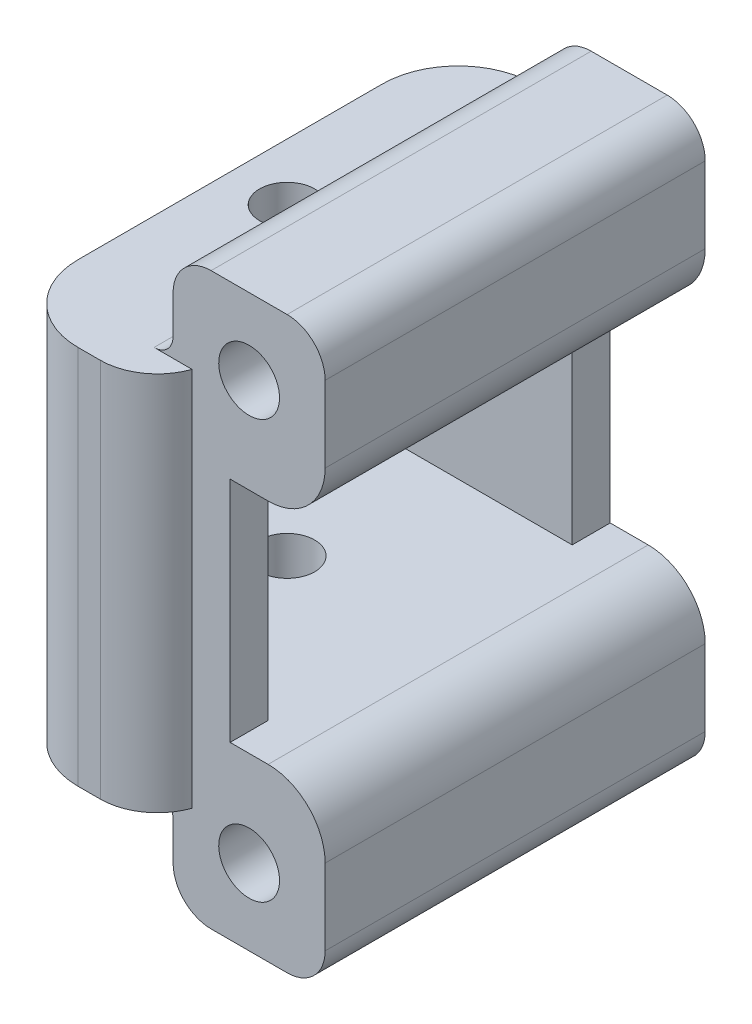
from build123d import *

# Parameters (mm, degrees)
SKETCH1_W           = 20
SKETCH1_H           = 20
BOSS_EXTRUDE1_DEPTH = 4
SKETCH2_R           = 3.7
CUT_EXTRUDE1_DEPTH  = 2.6
SKETCH3_R           = 2.1
CUT_EXTRUDE2_DEPTH  = 29.403520909
SKETCH4_W           = 12
SKETCH4_H           = 4
BOSS_EXTRUDE2_DEPTH = 12
SKETCH7_W           = 20
SKETCH7_H           = 4
BOSS_EXTRUDE3_DEPTH = 5
SKETCH8_W           = 8
SKETCH8_H           = 20
BOSS_EXTRUDE4_DEPTH = 5
SKETCH9_W           = 8
SKETCH9_H           = 20
BOSS_EXTRUDE5_DEPTH = 5
SKETCH10_R          = 1.6
CUT_EXTRUDE5_DEPTH  = 39.288379438
SKETCH11_W          = 30
SKETCH11_H          = 30
CUT_EXTRUDE6_DEPTH  = 6
SKETCH12_R          = 1.45
CUT_EXTRUDE7_DEPTH  = 39.288379438
SKETCH13_W          = 8
SKETCH13_H          = 20
BOSS_EXTRUDE6_DEPTH = 2
SKETCH14_W          = 8
SKETCH14_H          = 20
BOSS_EXTRUDE7_DEPTH = 2
SKETCH15_W          = 16
SKETCH15_H          = 12
CUT_EXTRUDE8_DEPTH  = 37.523964735
FILLET2_R           = 3
FILLET4_R           = 2
FILLET5_START       = -21
FILLET5_DEPTH       = 22
FILLET6_R           = 3
FILLET7_R           = 1
FILLET8_R           = 1


with BuildPart() as part:
    # Sketch1 → Boss-Extrude1 (new body)
    with BuildSketch(Plane(origin=(0, 0, 0), x_dir=(0, 0, -1), z_dir=(1, 0, 0))):
        with Locations((-10, -10)):
            Rectangle(SKETCH1_W, SKETCH1_H)
    extrude(amount=BOSS_EXTRUDE1_DEPTH)

    # Sketch2 → Cut-Extrude1 (cut)
    with BuildSketch(Plane(origin=(4, 0, 0), x_dir=(0, 0, -1), z_dir=(1, 0, 0))):
        with Locations((-10, -10)):
            Circle(SKETCH2_R)
    extrude(amount=-CUT_EXTRUDE1_DEPTH, mode=Mode.SUBTRACT)

    # Sketch3 → Cut-Extrude2 (cut, through all)
    with BuildSketch(Plane(origin=(1.4, 0, 0), x_dir=(0, 0, -1), z_dir=(1, 0, 0))):
        with Locations((-10, -10)):
            Circle(SKETCH3_R)
    extrude(amount=-CUT_EXTRUDE2_DEPTH, mode=Mode.SUBTRACT)

    # Sketch4 → Boss-Extrude2 (add)
    with BuildSketch(Plane(origin=(4, 0, 0), x_dir=(0, 0, -1), z_dir=(1, 0, 0))):
        Polygon((-20, 0), (-20, -20), (-16, -20), (-16, -16), (-16, -4), (-16, 0), align=None)
        with Locations((-10, -18)):
            Rectangle(SKETCH4_W, SKETCH4_H)
        Polygon((-4, -16), (-4, -20), (0, -20), (0, -4), (-4, -4), align=None)
        Polygon((0, 0), (-16, 0), (-16, -4), (-4, -4), (0, -4), align=None)
    extrude(amount=BOSS_EXTRUDE2_DEPTH)

    # Sketch7 → Boss-Extrude3 (add)
    with BuildSketch(Plane(origin=(16, 0, 0), x_dir=(0, 0, -1), z_dir=(1, 0, 0))):
        with Locations((-10, -18)):
            Rectangle(SKETCH7_W, SKETCH7_H)
        with Locations((-10, -2)):
            Rectangle(SKETCH7_W, SKETCH7_H)
    extrude(amount=BOSS_EXTRUDE3_DEPTH)

    # Sketch8 → Boss-Extrude4 (add)
    with BuildSketch(Plane(origin=(0, -20, 0), x_dir=(-1, 0, 0), z_dir=(0, -1, 0))):
        with Locations((-17, -10)):
            Rectangle(SKETCH8_W, SKETCH8_H)
    extrude(amount=BOSS_EXTRUDE4_DEPTH)

    # Sketch9 → Boss-Extrude5 (add)
    with BuildSketch(Plane(origin=(0, 0, 0), x_dir=(1, 0, 0), z_dir=(0, 1, 0))):
        with Locations((17, -10)):
            Rectangle(SKETCH9_W, SKETCH9_H)
    extrude(amount=BOSS_EXTRUDE5_DEPTH)

    # Sketch10 → Cut-Extrude5 (cut, through all)
    with BuildSketch(Plane(origin=(0, 0, 0), x_dir=(-1, 0, 0), z_dir=(0, 0, -1))):
        with Locations(Location((-17, 1, 0), (0, 0, 90))):
            Circle(SKETCH10_R)
        with Locations(Location((-17, -21, 0), (0, 0, 90))):
            Circle(SKETCH10_R)
    extrude(amount=-CUT_EXTRUDE5_DEPTH, mode=Mode.SUBTRACT)

    # Sketch11 → Cut-Extrude6 (cut)
    with BuildSketch(Plane.ZY):
        with Locations((15, -5)):
            Rectangle(SKETCH11_W, SKETCH11_H)
    extrude(amount=-CUT_EXTRUDE6_DEPTH, mode=Mode.SUBTRACT)

    # Sketch12 → Cut-Extrude7 (cut, through all)
    with BuildSketch(Plane(origin=(0, 0, 0), x_dir=(1, 0, 0), z_dir=(0, 1, 0))):
        with Locations(Location((9, -10, 0), (0, 0, 270))):
            Circle(SKETCH12_R)
    extrude(amount=-CUT_EXTRUDE7_DEPTH, mode=Mode.SUBTRACT)

    # Sketch13 → Boss-Extrude6 (add)
    with BuildSketch(Plane.XY.offset(20)):
        with Locations((10, -10)):
            Rectangle(SKETCH13_W, SKETCH13_H)
    extrude(amount=BOSS_EXTRUDE6_DEPTH)

    # Sketch14 → Boss-Extrude7 (add)
    with BuildSketch(Plane(origin=(0, 0, 0), x_dir=(-1, 0, 0), z_dir=(0, 0, -1))):
        with Locations((-10, -10)):
            Rectangle(SKETCH14_W, SKETCH14_H)
    extrude(amount=BOSS_EXTRUDE7_DEPTH)

    # Sketch15 → Cut-Extrude8 (cut, through all)
    with BuildSketch(Plane.ZY.offset(-6)):
        with Locations((10, -10)):
            Rectangle(SKETCH15_W, SKETCH15_H)
    extrude(amount=-CUT_EXTRUDE8_DEPTH, mode=Mode.SUBTRACT)

    # Fillet2
    fillet2_edges = [part.edges().sort_by_distance(p)[0] for p in [
        (21, -16, 10),
        (21, -4, 10),
    ]]
    fillet(fillet2_edges, radius=FILLET2_R)

    # Fillet4
    fillet4_edges = [part.edges().sort_by_distance(p)[0] for p in [
        (21, -25, 10),
        (13, -25, 10),
        (21, 5, 10),
        (13, 5, 10),
    ]]
    fillet(fillet4_edges, radius=FILLET4_R)

    # Fillet5: read off the stored shape, not the designer's step
    # Fillet5 outline → Fillet5 (cut)
    with BuildSketch(Plane(origin=(0, 0, 0), x_dir=(1, 0, 0), z_dir=(0, 1, 0)).offset(FILLET5_START)):
        with BuildLine():
            Line((6, 2), (6, -2))
            ThreePointArc((6, -2), (7.171572875, 0.828427125), (10, 2))
            Line((10, 2), (6, 2))
        make_face()
        with BuildLine():
            ThreePointArc((10, -22), (7.171572875, -20.828427125), (6, -18))
            Line((6, -18), (6, -22))
            Line((6, -22), (10, -22))
        make_face()
    extrude(amount=FILLET5_DEPTH, mode=Mode.SUBTRACT)

    # Fillet6
    # the kernel refuses this fillet: 3 mm, written as the material it takes off along each edge
    with BuildSketch(Plane(origin=(14, -27.071067812, -2), x_dir=(-1, 0, 0), z_dir=(0, 1, 0))) as fillet6_piece_1:
        with BuildLine():
            CenterArc((2.828427125, 3), FILLET6_R, 199.471220634, 70.528779366)
            Line((0, 2), (-0.056568542, 1.98))
            ThreePointArc((-0.056568542, 1.98), (-0.06, 1), (-0.06, 0))
            Line((-0.06, 0), (0, -0.06))
            Line((0, -0.06), (2.828427125, -0.06))
            Line((2.828427125, -0.06), (2.828427125, 0))
        make_face()
    extrude(amount=34.142135624, mode=Mode.SUBTRACT)
    with BuildSketch(Plane(origin=(14, -27.071067812, 22), x_dir=(0, 0, -1), z_dir=(0, 1, 0))) as fillet6_piece_2:
        with BuildLine():
            CenterArc((3, 2.828427125), FILLET6_R, 180, 70.528779366)
            Line((0, 2.828427125), (-0.06, 2.828427125))
            Line((-0.06, 2.828427125), (-0.06, 0))
            Line((-0.06, 0), (0, -0.06))
            ThreePointArc((0, -0.06), (1, -0.06), (1.98, -0.056568542))
            Line((1.98, -0.056568542), (2, 0))
        make_face()
    extrude(amount=34.142135624, mode=Mode.SUBTRACT)

    # Fillet7
    fillet7_edges = [part.edges().sort_by_distance(p)[0] for p in [
        (13, -20, 10),
    ]]
    fillet(fillet7_edges, radius=FILLET7_R)

    # Fillet8
    fillet8_edges = [part.edges().sort_by_distance(p)[0] for p in [
        (13, 0, 10),
    ]]
    fillet(fillet8_edges, radius=FILLET8_R)


solid = part.part
